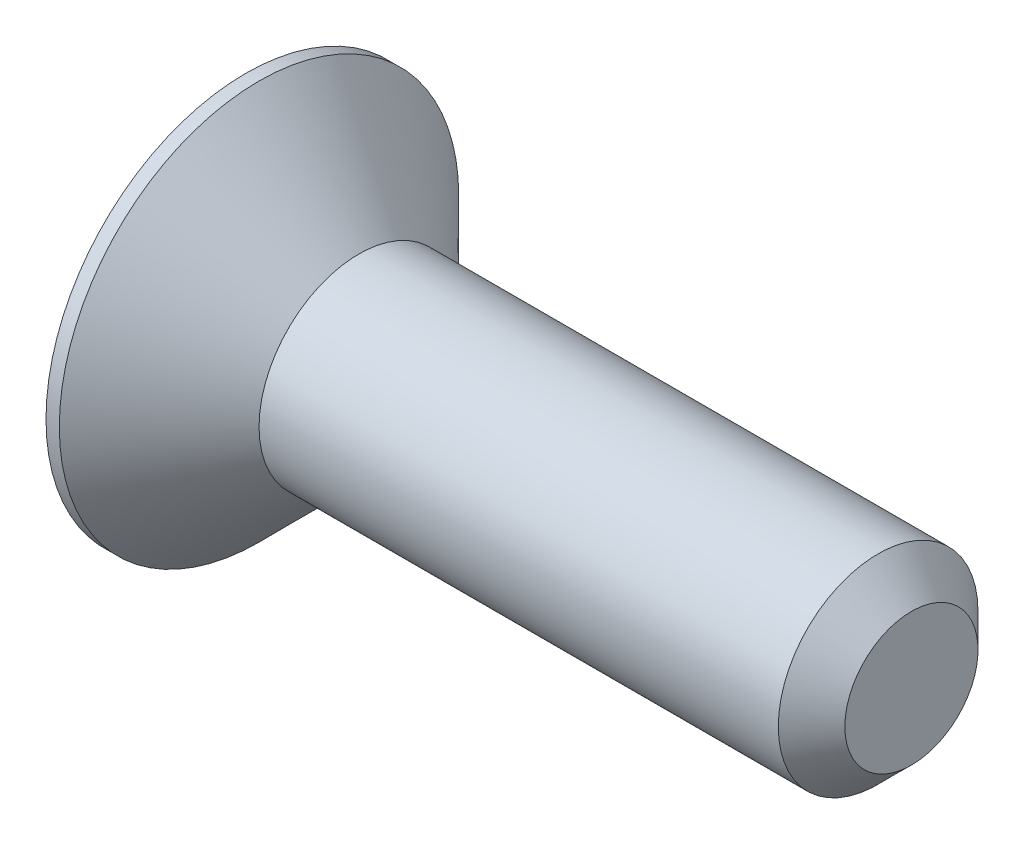
from build123d import *

# Parameters (mm, degrees)
CUT_EXTRUDE1_DEPTH = 1.1


with BuildPart() as part:
    # Sketch1 → Revolve1 (revolve)
    with BuildSketch(Plane.XY):
        Polygon((0, -1.5), (7.8, -1.5), (8.3, -1), (8.3, 0), (-1.7, 0), (-1.7, -3), (-1.5, -3), align=None)
    revolve(axis=Axis((-1.7, 0, 0), (1, 0, 0)))

    # Sketch2 → Cut-Extrude1 (cut)
    with BuildSketch(Plane.ZY.offset(1.7)):
        Polygon((0, 1.154700538), (-1, 0.577350269), (-1, -0.577350269), (0, -1.154700538), (1, -0.577350269), (1, 0.577350269), align=None)
    extrude(amount=-CUT_EXTRUDE1_DEPTH, mode=Mode.SUBTRACT)


solid = part.part
